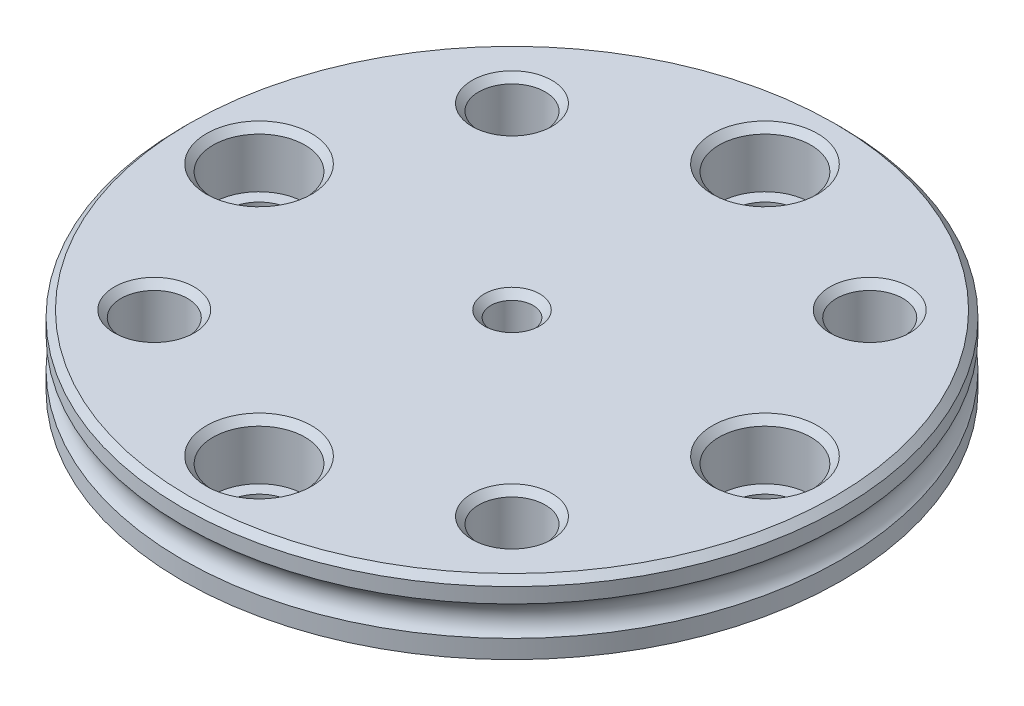
from build123d import *

# Parameters (mm, degrees)
SKETCH2_R           = 23.75
SKETCH2_R_2         = 2.5
SKETCH2_R_3         = 1.5875
BOSS_EXTRUDE2_DEPTH = 5
SKETCH3_R           = 3.45
CUT_EXTRUDE1_DEPTH  = 4
SKETCH5_R           = 2
CUT_EXTRUDE2_DEPTH  = 10
SKETCH6_R           = 4
CUT_EXTRUDE3_DEPTH  = 4
CHAMFER2_SIZE       = 1
SKETCH7_R           = 24.75
SKETCH7_R_2         = 2.5
SKETCH7_R_3         = 1.5875
SKETCH7_R_4         = 3.45
BOSS_EXTRUDE3_DEPTH = 0.25
CHAMFER3_SIZE       = 0.5
CIRPATTERN1_COUNT   = 12


with BuildPart() as part:
    # Sketch2 → Boss-Extrude2 (new body)
    with BuildSketch(Plane(origin=(0, 0, 0), x_dir=(-1, 0, 0), z_dir=(0, 1, 0))):
        with Locations(Location((0, 0, 0), (0, 0, 90))):
            Circle(SKETCH2_R)
        with Locations(Location((-13.435028843, 13.435028843, 0), (0, 0, 90))):
            Circle(SKETCH2_R_2, mode=Mode.SUBTRACT)
        with Locations(Location((13.435028843, 13.435028843, 0), (0, 0, 90))):
            Circle(SKETCH2_R_2, mode=Mode.SUBTRACT)
        with Locations(Location((0, 0, 0), (0, 0, 90))):
            Circle(SKETCH2_R_3, mode=Mode.SUBTRACT)
        with Locations(Location((13.435028843, -13.435028843, 0), (0, 0, 90))):
            Circle(SKETCH2_R_2, mode=Mode.SUBTRACT)
        with Locations(Location((0, 19, 0), (0, 0, 90))):
            Circle(SKETCH2_R_2, mode=Mode.SUBTRACT)
        with Locations(Location((19, 0, 0), (0, 0, 90))):
            Circle(SKETCH2_R_2, mode=Mode.SUBTRACT)
        with Locations(Location((0, -19, 0), (0, 0, 90))):
            Circle(SKETCH2_R_2, mode=Mode.SUBTRACT)
        with Locations(Location((-19, 0, 0), (0, 0, 90))):
            Circle(SKETCH2_R_2, mode=Mode.SUBTRACT)
        with Locations(Location((-13.435028843, -13.435028843, 0), (0, 0, 90))):
            Circle(SKETCH2_R_2, mode=Mode.SUBTRACT)
    extrude(amount=-BOSS_EXTRUDE2_DEPTH)

    # Sketch3 → Cut-Extrude1 (cut)
    with BuildSketch(Plane(origin=(0, 0, 0), x_dir=(1, 0, 0), z_dir=(0, 1, 0))):
        with Locations(Location((0, 19, 0), (0, 0, 270))):
            Circle(SKETCH3_R)
        with Locations(Location((19, 0, 0), (0, 0, 270))):
            Circle(SKETCH3_R)
        with Locations(Location((0, -19, 0), (0, 0, 270))):
            Circle(SKETCH3_R)
        with Locations(Location((-19, 0, 0), (0, 0, 270))):
            Circle(SKETCH3_R)
    extrude(amount=-CUT_EXTRUDE1_DEPTH, mode=Mode.SUBTRACT)

    # Sketch4 → Revolve1 (revolve)
    with BuildSketch(Plane.XY, mode=Mode.PRIVATE) as revolve1_sk:
        with BuildLine():
            Line((-24.75, 0), (-23.75, 0))
            Line((-23.75, 0), (-23.75, -5))
            Line((-23.75, -5), (-24.75, -5))
            Line((-24.75, -5), (-24.75, -3.618033989))
            ThreePointArc((-24.75, -3.618033989), (-24.25, -2.5), (-24.75, -1.381966011))
            Line((-24.75, -1.381966011), (-24.75, 0))
        make_face()
        with BuildLine():
            Line((-26.75, -5), (-26.75, -3.618033989))
            ThreePointArc((-26.75, -3.618033989), (-27.25, -2.5), (-26.75, -1.381966011))
            Line((-26.75, -1.381966011), (-26.75, 0))
            Line((-26.75, 0), (-35, 0))
            Line((-35, 0), (-35, -5))
            Line((-35, -5), (-26.75, -5))
        make_face()
    revolve(revolve1_sk.sketch.rotate(Axis((0, -2.5, 0), (0, 1, 0)), 270), axis=Axis((0, -2.5, 0), (0, 1, 0)))


with BuildPart() as revolve1_piece_1:
    # of the separate pieces the step leaves, piece 1, a body of its own (revolve1_pieces)
    add(part.part.solids().sort_by_distance((13.435028843, 0, -10.935028843))[0])

    # Sketch7 → Boss-Extrude3 (add)
    with BuildSketch(Plane(origin=(0, 0, 0), x_dir=(1, 0, 0), z_dir=(0, 1, 0))):
        with Locations(Location((0, 0, 0), (0, 0, 90))):
            Circle(SKETCH7_R)
        with Locations(Location((13.435028843, 13.435028843, 0), (0, 0, 270))):
            Circle(SKETCH7_R_2, mode=Mode.SUBTRACT)
        with Locations(Location((-13.435028843, 13.435028843, 0), (0, 0, 270))):
            Circle(SKETCH7_R_2, mode=Mode.SUBTRACT)
        with Locations(Location((0, 0, 0), (0, 0, 270))):
            Circle(SKETCH7_R_3, mode=Mode.SUBTRACT)
        with Locations(Location((-13.435028843, -13.435028843, 0), (0, 0, 270))):
            Circle(SKETCH7_R_2, mode=Mode.SUBTRACT)
        with Locations(Location((13.435028843, -13.435028843, 0), (0, 0, 270))):
            Circle(SKETCH7_R_2, mode=Mode.SUBTRACT)
        with Locations(Location((-19, 0, 0), (0, 0, 270))):
            Circle(SKETCH7_R_4, mode=Mode.SUBTRACT)
        with Locations(Location((0, -19, 0), (0, 0, 270))):
            Circle(SKETCH7_R_4, mode=Mode.SUBTRACT)
        with Locations(Location((19, 0, 0), (0, 0, 270))):
            Circle(SKETCH7_R_4, mode=Mode.SUBTRACT)
        with Locations(Location((0, 19, 0), (0, 0, 270))):
            Circle(SKETCH7_R_4, mode=Mode.SUBTRACT)
    extrude(amount=BOSS_EXTRUDE3_DEPTH)

    # Chamfer3
    chamfer3_edges = [revolve1_piece_1.edges().sort_by_distance(p)[0] for p in [
        (0, 0.25, 24.75),
        (13.435028843, 0.25, -15.935028843),
        (-13.435028843, 0.25, -15.935028843),
        (0, 0.25, -1.5875),
        (-13.435028843, 0.25, 10.935028843),
        (13.435028843, 0.25, 10.935028843),
        (-19, 0.25, -3.45),
        (0, 0.25, 15.55),
        (19, 0.25, -3.45),
        (0, 0.25, -22.45),
    ]]
    chamfer(chamfer3_edges, length=CHAMFER3_SIZE)


with BuildPart() as revolve1_piece_2:
    # of the separate pieces the step leaves, piece 2, a body of its own (revolve1_pieces)
    add(part.part.solids().sort_by_distance((0, -5, -26.75))[0])

    # Sketch5 → Cut-Extrude2 (cut)
    with BuildSketch(Plane(origin=(0, 0, 0), x_dir=(1, 0, 0), z_dir=(0, 1, 0))):
        with Locations(Location((0, 32.5, 0), (0, 0, 270))):
            Circle(SKETCH5_R)
        with Locations(Location((32.5, 0, 0), (0, 0, 270))):
            Circle(SKETCH5_R)
        with Locations(Location((0, -32.5, 0), (0, 0, 270))):
            Circle(SKETCH5_R)
        with Locations(Location((-32.5, 0, 0), (0, 0, 270))):
            Circle(SKETCH5_R)
    extrude(amount=-CUT_EXTRUDE2_DEPTH, mode=Mode.SUBTRACT)

    # Sketch6 → Cut-Extrude3 (cut)
    with BuildSketch(Plane(origin=(0, 0, 0), x_dir=(1, 0, 0), z_dir=(0, 1, 0))):
        with Locations((0, -32.5)):
            Circle(SKETCH6_R)
        with Locations((-32.5, 0)):
            Circle(SKETCH6_R)
        with Locations((0, 32.5)):
            Circle(SKETCH6_R)
        with Locations((32.5, 0)):
            Circle(SKETCH6_R)
    extrude(amount=-CUT_EXTRUDE3_DEPTH, mode=Mode.SUBTRACT)

    # Chamfer2
    # the kernel refuses this chamfer: 1 mm, written as the material it takes off along each edge
    with BuildSketch(Plane(origin=(0, 0, 0), x_dir=(0.019114321981189532, 0, 0.9998173046588058), z_dir=(-0.9998173046588058, 0, 0.019114321981189532))) as chamfer2_piece_1:
        Polygon((35 - CHAMFER2_SIZE, 0), (35, -CHAMFER2_SIZE), (35, 0), align=None)
    revolve(axis=Axis((0, 0, 0), (0, 1, 0)), revolution_arc=87.809526646, mode=Mode.SUBTRACT)
    with BuildSketch(Plane(origin=(0, 0, 0), x_dir=(-0.9998173046588067, 0, 0.019114321981147413), z_dir=(-0.019114321981147413, 0, -0.9998173046588067))) as chamfer2_piece_2:
        Polygon((35 - CHAMFER2_SIZE, 0), (35, -CHAMFER2_SIZE), (35, 0), align=None)
    revolve(axis=Axis((0, 0, 0), (0, 1, 0)), revolution_arc=87.809526646, mode=Mode.SUBTRACT)
    with BuildSketch(Plane(origin=(0, 0, 0), x_dir=(-0.019114321981182705, 0, -0.999817304658806), z_dir=(0.999817304658806, 0, -0.019114321981182705))) as chamfer2_piece_3:
        Polygon((35 - CHAMFER2_SIZE, 0), (35, -CHAMFER2_SIZE), (35, 0), align=None)
    revolve(axis=Axis((0, 0, 0), (0, 1, 0)), revolution_arc=87.809526646, mode=Mode.SUBTRACT)
    with BuildSketch(Plane(origin=(0, 0, 32.5), x_dir=(-0.29349569960602556, -1.3653955404004917e-15, 0.9559603936946184), z_dir=(0.9559603936946184, 1.4794691735989965e-15, 0.29349569960602556))) as chamfer2_piece_4:
        Polygon((4 + CHAMFER2_SIZE, 0), (4, CHAMFER2_SIZE), (4, 0), align=None)
    revolve(axis=Axis((0, 0, 32.5), (0, -1, 0)), revolution_arc=325.865290322, mode=Mode.SUBTRACT)
    with BuildSketch(Plane(origin=(-32.5, 0, 0), x_dir=(-0.9559603936947099, -1.386827160904714e-15, -0.2934956996057275), z_dir=(-0.2934956996057275, 7.472387430751279e-15, 0.9559603936947099))) as chamfer2_piece_5:
        Polygon((4 + CHAMFER2_SIZE, 0), (4, CHAMFER2_SIZE), (4, 0), align=None)
    revolve(axis=Axis((-32.5, 0, 0), (0, -1, 0)), revolution_arc=325.865290322, mode=Mode.SUBTRACT)
    with BuildSketch(Plane(origin=(0, 0, 0), x_dir=(0.9998173046588067, 0, -0.0191143219811504), z_dir=(0.0191143219811504, 0, 0.9998173046588067))) as chamfer2_piece_6:
        Polygon((35 - CHAMFER2_SIZE, 0), (35, -CHAMFER2_SIZE), (35, 0), align=None)
    revolve(axis=Axis((0, 0, 0), (0, 1, 0)), revolution_arc=87.809526646, mode=Mode.SUBTRACT)
    with BuildSketch(Plane(origin=(0, 0, -32.5), x_dir=(-0.29349569960600574, -1.3653955404004456e-15, -0.9559603936946244), z_dir=(0.9559603936946244, 1.4794691735989516e-15, -0.29349569960600574))) as chamfer2_piece_7:
        Polygon((4 + CHAMFER2_SIZE, 0), (4, -CHAMFER2_SIZE), (4, 0), align=None)
    revolve(axis=Axis((0, 0, -32.5), (0, 1, 0)), revolution_arc=325.865290322, mode=Mode.SUBTRACT)
    with BuildSketch(Plane(origin=(0, 0, 0), x_dir=(0, 0, -1), z_dir=(1, 0, 0))) as chamfer2_piece_8:
        Polygon((26.75, -CHAMFER2_SIZE), (26.75 + CHAMFER2_SIZE, 0), (26.75, 0), align=None)
    revolve(axis=Axis((0, 0, 0), (0, 1, 0)), mode=Mode.SUBTRACT)
    with BuildSketch(Plane(origin=(32.5, 0, 0), x_dir=(0.9559603936946928, 0, -0.2934956996057833), z_dir=(0.2934956996057833, 0, 0.9559603936946928))) as chamfer2_piece_9:
        Polygon((4 + CHAMFER2_SIZE, 0), (4, -CHAMFER2_SIZE), (4, 0), align=None)
    revolve(axis=Axis((32.5, 0, 0), (0, 1, 0)), revolution_arc=325.865290322, mode=Mode.SUBTRACT)


with BuildPart() as body_3:
    # Sketch8 → Revolve2 (revolve)
    with BuildSketch(Plane.XY):
        with BuildLine():
            Line((25.75, -1), (25.75, -4))
            ThreePointArc((25.75, -4), (24.25, -2.5), (25.75, -1))
        make_face()
    revolve(axis=Axis((25.75, -1, 0), (0, -1, 0)))


with BuildPart() as cirpattern1_1:
    # CirPattern1: pattern copy
    add(body_3.part.rotate(Axis((0, 0, 0), (0, 1, 0)), 1 * 360 / CIRPATTERN1_COUNT))


with BuildPart() as cirpattern1_2:
    # CirPattern1: pattern copy
    add(body_3.part.rotate(Axis((0, 0, 0), (0, 1, 0)), 2 * 360 / CIRPATTERN1_COUNT))


with BuildPart() as cirpattern1_3:
    # CirPattern1: pattern copy
    add(body_3.part.rotate(Axis((0, 0, 0), (0, 1, 0)), 3 * 360 / CIRPATTERN1_COUNT))


with BuildPart() as cirpattern1_4:
    # CirPattern1: pattern copy
    add(body_3.part.rotate(Axis((0, 0, 0), (0, 1, 0)), 4 * 360 / CIRPATTERN1_COUNT))


with BuildPart() as cirpattern1_5:
    # CirPattern1: pattern copy
    add(body_3.part.rotate(Axis((0, 0, 0), (0, 1, 0)), 5 * 360 / CIRPATTERN1_COUNT))


with BuildPart() as cirpattern1_6:
    # CirPattern1: pattern copy
    add(body_3.part.rotate(Axis((0, 0, 0), (0, 1, 0)), 6 * 360 / CIRPATTERN1_COUNT))


with BuildPart() as cirpattern1_7:
    # CirPattern1: pattern copy
    add(body_3.part.rotate(Axis((0, 0, 0), (0, 1, 0)), 7 * 360 / CIRPATTERN1_COUNT))


with BuildPart() as cirpattern1_8:
    # CirPattern1: pattern copy
    add(body_3.part.rotate(Axis((0, 0, 0), (0, 1, 0)), 8 * 360 / CIRPATTERN1_COUNT))


with BuildPart() as cirpattern1_9:
    # CirPattern1: pattern copy
    add(body_3.part.rotate(Axis((0, 0, 0), (0, 1, 0)), 9 * 360 / CIRPATTERN1_COUNT))


with BuildPart() as cirpattern1_10:
    # CirPattern1: pattern copy
    add(body_3.part.rotate(Axis((0, 0, 0), (0, 1, 0)), 10 * 360 / CIRPATTERN1_COUNT))


with BuildPart() as cirpattern1_11:
    # CirPattern1: pattern copy
    add(body_3.part.rotate(Axis((0, 0, 0), (0, 1, 0)), 11 * 360 / CIRPATTERN1_COUNT))


solid = revolve1_piece_1.part
